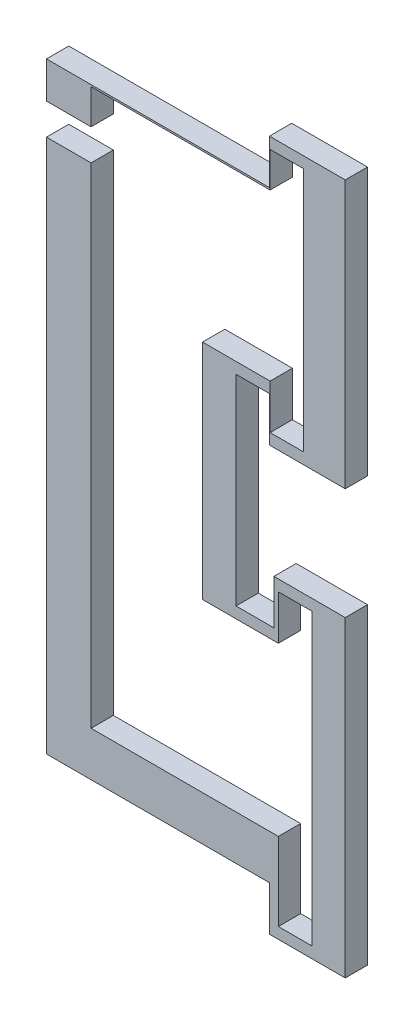
from build123d import *

# Parameters (mm, degrees)
BOSS_EXTRUDE1_DEPTH = 5


with BuildPart() as part:
    # Sketch1 → Boss-Extrude1 (new body)
    with BuildSketch(Plane.XY):
        Polygon((0, 0), (0, 119.8), (10, 119.8), (10, 10), (52, 10), (52, -3.168829952), (52, -7.5), (59.5, -7.5), (59.5, 57.5), (52, 57.5), (52, 52.5), (52, 47.5), (35, 47.5), (35, 97.5), (50.15, 97.5), (50.15, 95), (50.15, 87.5), (57.65, 87.5), (57.65, 142.5), (50.15, 142.5), (50.15, 135), (50.15, 134.6), (10, 134.6), (10, 126.8), (0, 126.8), (0, 135), (50, 135), (50, 145), (67, 145), (67, 85), (50, 85), (50, 95), (42.5, 95), (42.5, 50), (51, 50), (51, 59.850807945), (51, 60), (67, 60), (67, -10), (50, -10), (50, -7.5), (50, 0), align=None)
    extrude(amount=BOSS_EXTRUDE1_DEPTH)


solid = part.part
